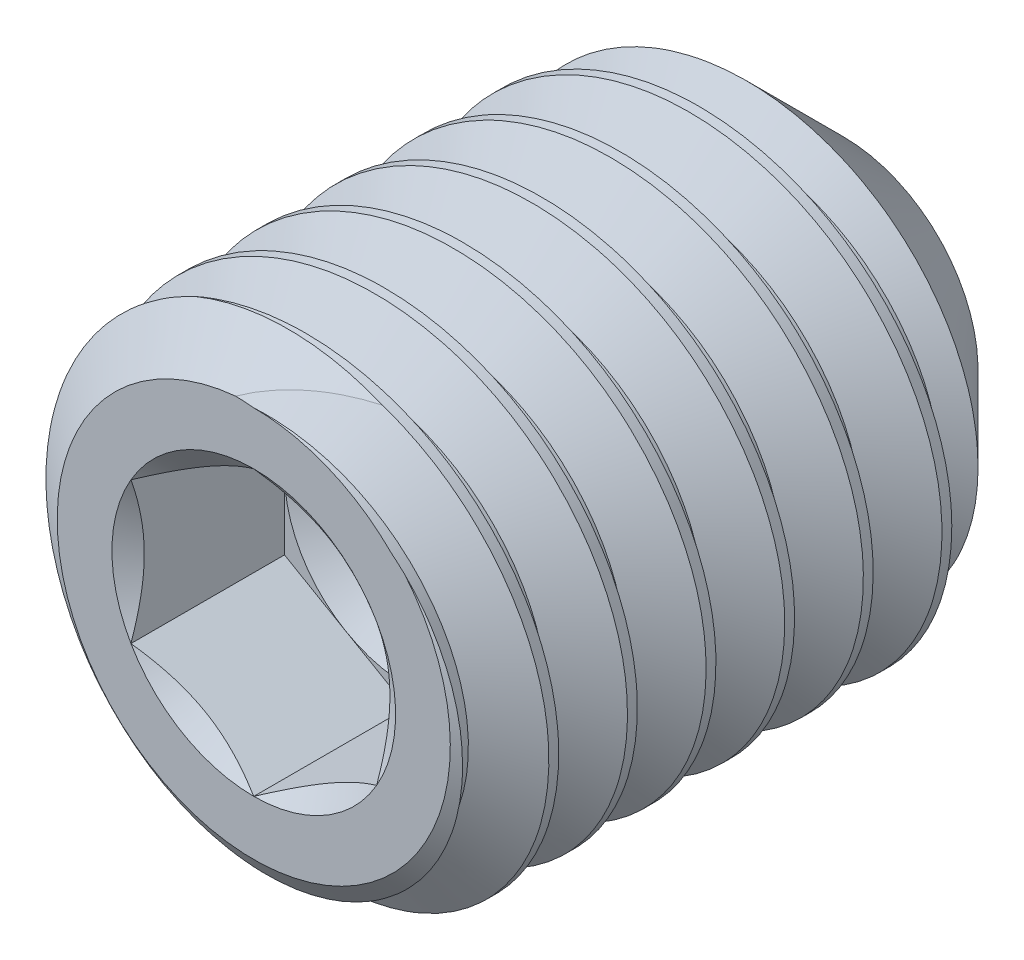
from build123d import *

# Parameters (mm, degrees)
CUT_SWEEP_PITCH   = 0.8
HEX_EXTRUDE_DEPTH = 1.5625


with BuildPart() as part:
    # Body Sketch → Body Revolve (revolve)
    with BuildSketch(Plane(origin=(0, 0, 0), x_dir=(0, 0, -1), z_dir=(1, 0, 0))):
        Polygon((-2.588436834, 0), (-2.588436834, 2), (-2.238333065, 2.5), (2.281475432, 2.5), (3.411563166, 1.369912266), (2.588436834, 0), align=None)
    revolve(axis=Axis((0, 0, -2.588436834), (0, 0, 1)))

    # Cut Sweep: the profile of Cut Sweep Sketch profile screwed along a right-hand helix of 8.5 turns, 8 arcs to a turn; built about Z, then put on its axis
    cut_sweep_z = Axis((0, 0, 0), (0, 0, 1))
    cut_sweep_corners = [(2.5003, 0, 0.000173205), (2.5003, 0, -0.700173205), (1.980384758, 0, -0.4), (1.980384758, 0, -0.3)]
    with BuildLine(mode=Mode.PRIVATE) as cut_sweep_profile:
        Line(cut_sweep_corners[0], cut_sweep_corners[1])
        Line(cut_sweep_corners[1], cut_sweep_corners[2])
        Line(cut_sweep_corners[2], cut_sweep_corners[3])
        Line(cut_sweep_corners[3], cut_sweep_corners[0])
    cut_sweep_cap = Face(cut_sweep_profile.wire())
    cut_sweep_turn_angles = [0, 22.5, 45, 67.5, 90, 112.5, 135, 157.5, 180, 202.5, 225, 247.5, 270, 292.5, 315, 337.5, 360]
    cut_sweep_turn_weights = [1, 0.9238795325112867, 1, 0.9238795325112867, 1, 0.9238795325112867, 1, 0.9238795325112867, 1, 0.9238795325112867, 1, 0.9238795325112867, 1, 0.9238795325112867, 1, 0.9238795325112867, 1]
    cut_sweep_turn_rails = [Edge.make_bspline([Vector(p[0], p[1], 0).rotate(cut_sweep_z, cut_sweep_turn_angles[k]) / cut_sweep_turn_weights[k] + Vector(0, 0, p[2] + CUT_SWEEP_PITCH * cut_sweep_turn_angles[k] / 360) for k in range(17)], [0, 0, 0, 1, 1, 2, 2, 3, 3, 4, 4, 5, 5, 6, 6, 7, 7, 8, 8, 8], 2, cut_sweep_turn_weights) for p in cut_sweep_corners]
    cut_sweep_turn_sides = [Face.make_surface_from_curves(cut_sweep_turn_rails[p[0]], cut_sweep_turn_rails[p[1]]) for p in [(0, 1), (1, 2), (2, 3), (3, 0)]]
    cut_sweep_last_angles = [2880, 2902.5, 2925, 2947.5, 2970, 2992.5, 3015, 3037.5, 3060]
    cut_sweep_last_weights = [1, 0.9238795325112867, 1, 0.9238795325112867, 1, 0.9238795325112867, 1, 0.9238795325112852, 1]
    cut_sweep_last_rails = [Edge.make_bspline([Vector(p[0], p[1], 0).rotate(cut_sweep_z, cut_sweep_last_angles[k]) / cut_sweep_last_weights[k] + Vector(0, 0, p[2] + CUT_SWEEP_PITCH * cut_sweep_last_angles[k] / 360) for k in range(9)], [0, 0, 0, 1, 1, 2, 2, 3, 3, 4, 4, 4], 2, cut_sweep_last_weights) for p in cut_sweep_corners]
    cut_sweep_last_sides = [Face.make_surface_from_curves(cut_sweep_last_rails[p[0]], cut_sweep_last_rails[p[1]]) for p in [(0, 1), (1, 2), (2, 3), (3, 0)]]
    cut_sweep = Plane(origin=(0, 0, -3.411563166), x_dir=(0, 1, 0), z_dir=(0, 0, 1)) * Solid(Shell([*[p.moved(Location((0, 0, CUT_SWEEP_PITCH * i))) for i in range(8) for p in cut_sweep_turn_sides], *cut_sweep_last_sides, cut_sweep_cap, cut_sweep_cap.rotate(cut_sweep_z, 3060).moved(Location((0, 0, CUT_SWEEP_PITCH * 3060 / 360)))]))
    add(cut_sweep, mode=Mode.SUBTRACT)

    # Hex Sketch → Hex Extrude (cut)
    with BuildSketch(Plane.XY.offset(2.588436834)):
        Polygon((0, 1.443375673), (-1.25, 0.721687836), (-1.25, -0.721687836), (0, -1.443375673), (1.25, -0.721687836), (1.25, 0.721687836), align=None)
    extrude(amount=-HEX_EXTRUDE_DEPTH, mode=Mode.SUBTRACT)

    # Hex Entry Extrude cone 1 section (through the dimple's axis) → Hex Entry Extrude (revolve, cut)
    with BuildSketch(Plane(origin=(0, 0, 2.588436834), x_dir=(0, -1, 0), z_dir=(1, 0, 0))):
        Polygon((0, 0), (1.443375673, 0), (0, 1.010662527), align=None)
    revolve(axis=Axis((0, 0, 2.588436834), (0, 0, -1)), mode=Mode.SUBTRACT)

    # Hex Bottom Extrude cone 1 section (through the dimple's axis) → Hex Bottom Extrude (revolve, cut)
    with BuildSketch(Plane(origin=(0, 0, 1.025936834), x_dir=(0, -1, 0), z_dir=(1, 0, 0))):
        Polygon((0, 0), (1.25, 0), (0, 0.721687836), align=None)
    revolve(axis=Axis((0, 0, 1.025936834), (0, 0, -1)), mode=Mode.SUBTRACT)


solid = part.part
